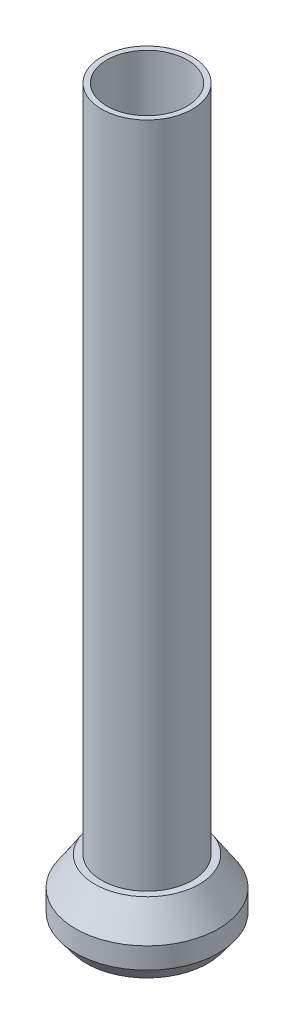
from build123d import *

# Parameters (mm, degrees)
SKETCH1_R           = 12.7
SKETCH1_R_2         = 11.227
BOSS_EXTRUDE1_DEPTH = 205


with BuildPart() as part:
    # Sketch1 → Boss-Extrude1 (new body)
    with BuildSketch(Plane(origin=(0, 0, 0), x_dir=(1, 0, 0), z_dir=(0, 1, 0))):
        Circle(SKETCH1_R)
        Circle(SKETCH1_R_2, mode=Mode.SUBTRACT)
    extrude(amount=BOSS_EXTRUDE1_DEPTH)

    # Sketch2 → Revolve1 (revolve)
    with BuildSketch(Plane.XY):
        Polygon((0, 0), (17, 0), (20, 4), (20, 9.9), (14.605, 18), (0, 18), align=None)
    revolve(axis=Axis((0, -10, 0), (0, 1, 0)))


solid = part.part
